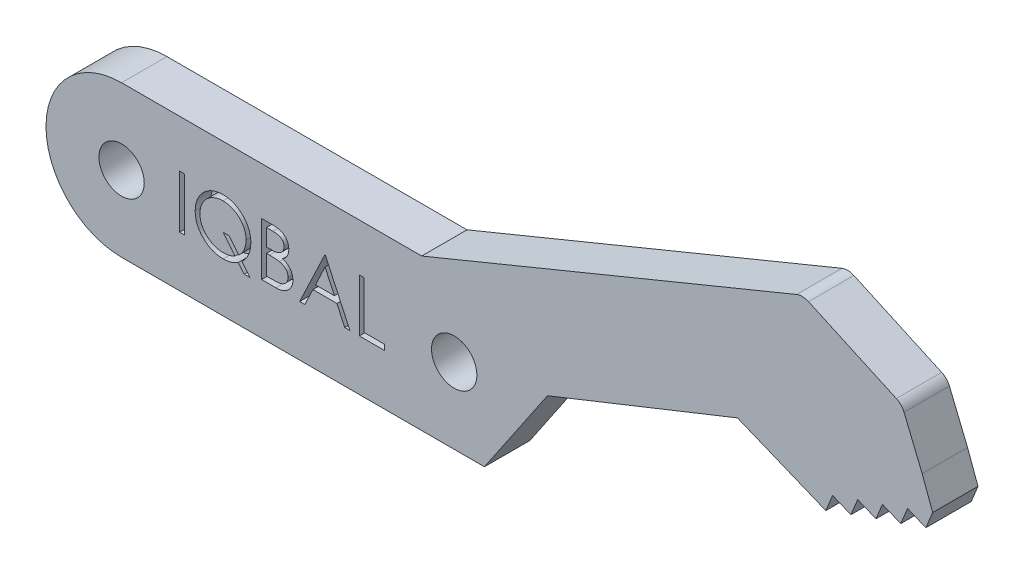
from build123d import *

# Parameters (mm, degrees)
SKETCH1_R           = 1.5
BOSS_EXTRUDE1_DEPTH = 3
SKETCH2_W           = 0.314102564
SKETCH2_H           = 3.5
CUT_EXTRUDE1_DEPTH  = 1


with BuildPart() as part:
    # Sketch1 → Boss-Extrude1 (new body)
    with BuildSketch(Plane.XY):
        with BuildLine():
            Line((0, 5), (19.85, 5))
            Line((19.85, 5), (44.643069029, 15.193663072))
            ThreePointArc((44.643069029, 15.193663072), (45.042006379, 15.268610471), (45.43786686, 15.178818479))
            Line((45.43786686, 15.178818479), (51.245085043, 12.533540635))
            ThreePointArc((51.245085043, 12.533540635), (51.550738574, 12.317286013), (51.755428853, 12.003770413))
            Line((51.755428853, 12.003770413), (52.954960556, 9.086264498))
            Line((52.954960556, 9.086264498), (53.647413738, 7.201821951))
            Line((53.647413738, 7.201821951), (53.200417763, 6.109762155))
            Line((53.200417763, 6.109762155), (51.987413738, 6.606262365))
            Line((51.987413738, 6.606262365), (51.540417763, 5.514202569))
            Line((51.540417763, 5.514202569), (50.327413738, 6.010702778))
            Line((50.327413738, 6.010702778), (49.901790908, 4.970859901))
            Line((49.901790908, 4.970859901), (48.688786884, 5.467360111))
            Line((48.688786884, 5.467360111), (48.241790908, 4.375300315))
            Line((48.241790908, 4.375300315), (47.028786884, 4.871800524))
            Line((47.028786884, 4.871800524), (46.581790908, 3.779740729))
            Line((46.581790908, 3.779740729), (40.742047423, 6.170032768))
            Line((40.742047423, 6.170032768), (28.174379319, 1.158584034))
            Line((28.174379319, 1.158584034), (24, -5))
            Line((24, -5), (22, -5))
            Line((22, -5), (0, -5))
            ThreePointArc((0, -5), (-5, 0), (0, 5))
        make_face()
        Circle(SKETCH1_R, mode=Mode.SUBTRACT)
        with Locations((22, 0)):
            Circle(SKETCH1_R, mode=Mode.SUBTRACT)
    extrude(amount=BOSS_EXTRUDE1_DEPTH)

    # Sketch2 → Cut-Extrude1 (cut)
    # profile 1 of 5: a face of its own
    with BuildSketch(Plane.XY.offset(3)):
        with Locations((3.993825044, 0.107803469)):
            Rectangle(SKETCH2_W, SKETCH2_H)
    # profile 2 of 5: a face of its own
    with BuildSketch(Plane.XY.offset(3)):
        with BuildLine():
            Line((7.965680012, -1.252372813), (8.503440429, -1.9114273))
            Line((8.503440429, -1.9114273), (8.111513345, -1.9114273))
            Line((8.111513345, -1.9114273), (7.723091871, -1.436066723))
            add(Edge.make_bspline(
                [(7.723091871, -1.436066723), (7.684134778, -1.459740459), (7.606938214, -1.506651841), (7.486571576, -1.567118007), (7.363811276, -1.617433745), (7.238928933, -1.659003719), (7.112106445, -1.692278045), (6.982700706, -1.715371834), (6.851181062, -1.72878211), (6.76281866, -1.730883437), (6.718384339, -1.731940121)],
                knots=[0, 0, 0, 0, 1.030216282, 2.041455142, 3.041201647, 4.026904037, 5.014869161, 6.002481075, 6.995518502, 8, 8, 8, 8], degree=3))
            add(Edge.make_bspline(
                [(6.718384339, -1.731940121), (6.654723998, -1.730406774), (6.529459398, -1.727389605), (6.345489281, -1.701049148), (6.168905662, -1.660368629), (6.000060511, -1.601507964), (5.838769899, -1.526325482), (5.685108761, -1.433636206), (5.538998996, -1.324723991), (5.402597406, -1.200300612), (5.277871988, -1.064945306), (5.16843325, -0.920324267), (5.075380753, -0.768837308), (5.000142267, -0.609729009), (4.940430472, -0.444384522), (4.899738504, -0.271428727), (4.873399066, -0.091891207), (4.870364698, 0.030351964), (4.868825044, 0.09237879)],
                knots=[0, 0, 0, 0, 1.055750571, 2.07740284, 3.077223765, 4.05828044, 5.038417088, 6.02463293, 7.030503776, 8.057169806, 9.083586829, 10.080154041, 11.061747002, 12.027853603, 12.995569715, 13.972756451, 14.971366004, 16, 16, 16, 16], degree=3))
            add(Edge.make_bspline(
                [(4.868825044, 0.09237879), (4.869372837, 0.134010073), (4.870464573, 0.216980146), (4.883093725, 0.339867317), (4.901857515, 0.460731448), (4.928398168, 0.579070275), (4.963142097, 0.695368853), (5.004796481, 0.809397858), (5.055266311, 0.920863466), (5.112321229, 1.029537543), (5.175953829, 1.134478204), (5.245270265, 1.234191863), (5.320441061, 1.327695836), (5.401413001, 1.414947342), (5.48786271, 1.49613925), (5.57904679, 1.572608549), (5.676909467, 1.641510498), (5.778867841, 1.705586547), (5.885493686, 1.76193256), (5.994701401, 1.812304094), (6.107307918, 1.853174247), (6.22185216, 1.888000569), (6.339029055, 1.914588478), (6.458747278, 1.933214717), (6.580922607, 1.945965684), (6.663430247, 1.947016716), (6.705063025, 1.947547059)],
                knots=[0, 0, 0, 0, 1.030721839, 2.054201982, 3.056261636, 4.058906239, 5.055198403, 6.060579377, 7.06322398, 8.083343201, 9.098870418, 10.10084648, 11.0888991, 12.067804703, 13.046436456, 14.024708667, 15.012489976, 16.008294399, 17.005242112, 17.997338632, 18.984424362, 19.969624474, 20.960977749, 21.957320355, 22.969278161, 24, 24, 24, 24], degree=3))
            add(Edge.make_bspline(
                [(6.705063025, 1.947547059), (6.768723603, 1.946021411), (6.893757054, 1.94302494), (7.077271416, 1.916680511), (7.253334828, 1.875836749), (7.421821952, 1.817276052), (7.58258257, 1.741904233), (7.735549141, 1.64923364), (7.880958825, 1.54031421), (8.016647672, 1.415882499), (8.141079338, 1.280193658), (8.249998939, 1.134783994), (8.342668907, 0.981817341), (8.418043039, 0.821057029), (8.476595032, 0.652568754), (8.517524458, 0.47628393), (8.543743098, 0.292517011), (8.546772606, 0.167255506), (8.548312223, 0.103596738)],
                knots=[0, 0, 0, 0, 1.050672203, 2.063587442, 3.054842799, 4.031180399, 5.003107577, 5.981273811, 6.979214548, 7.998088659, 9.016962771, 10.014903508, 10.993069742, 11.96499692, 12.941334519, 13.932589877, 14.949327797, 16, 16, 16, 16], degree=3))
            add(Edge.make_bspline(
                [(8.548312223, 0.103596738), (8.546629605, 0.037359372), (8.543320832, -0.092892658), (8.515162604, -0.283893384), (8.469889118, -0.46634407), (8.405685846, -0.640125176), (8.322685524, -0.805205113), (8.222491658, -0.963234697), (8.103897902, -1.114202725), (8.012237847, -1.20583108), (7.965680012, -1.252372813)],
                knots=[0, 0, 0, 0, 1.045660934, 2.056233022, 3.041853582, 4.009978652, 4.97562384, 5.954545411, 6.961031197, 8, 8, 8, 8], degree=3))
        make_face()
        with BuildLine():
            add(Edge.make_bspline(
                [(7.754642352, -0.993658871), (7.792831033, -0.954875898), (7.867949861, -0.87858807), (7.965415064, -0.753480069), (8.049244916, -0.623432837), (8.116359839, -0.486716437), (8.169758911, -0.345043724), (8.206651804, -0.197292139), (8.229751885, -0.044134317), (8.232712809, 0.060045038), (8.234209659, 0.112711322)],
                knots=[0, 0, 0, 0, 1.052210109, 2.069743939, 3.061837814, 4.040478349, 5.010453814, 5.985306305, 6.981502329, 8, 8, 8, 8], degree=3))
            add(Edge.make_bspline(
                [(8.234209659, 0.112711322), (8.233818555, 0.146627754), (8.23304541, 0.213674565), (8.222414686, 0.312892082), (8.207375373, 0.409918251), (8.185603057, 0.504579713), (8.157565664, 0.59668468), (8.122937021, 0.686108117), (8.082391812, 0.773138513), (8.035124957, 0.857235237), (7.98301725, 0.938276401), (7.925014978, 1.015270912), (7.861934558, 1.087821762), (7.794465115, 1.157124557), (7.721305837, 1.22175071), (7.642719102, 1.281672519), (7.559673276, 1.338340074), (7.471757414, 1.389489858), (7.381160145, 1.436514103), (7.288411587, 1.477234188), (7.194290522, 1.511722642), (7.098942702, 1.539688349), (7.002491507, 1.561700921), (6.904767838, 1.576723406), (6.806024409, 1.587343184), (6.73967994, 1.588162512), (6.706465268, 1.5885727)],
                knots=[0, 0, 0, 0, 1.032958288, 2.041976502, 3.037103433, 4.023477888, 4.998866292, 5.968231228, 6.943073582, 7.921783703, 8.90545537, 9.876780072, 10.85618943, 11.833110341, 12.821898168, 13.827467856, 14.842673888, 15.88323808, 16.924703457, 17.951432745, 18.967462636, 19.976958182, 20.977218729, 21.979378626, 22.98839684, 24, 24, 24, 24], degree=3))
            add(Edge.make_bspline(
                [(6.706465268, 1.5885727), (6.673017507, 1.58815965), (6.606207899, 1.58733461), (6.506987753, 1.576782143), (6.409039808, 1.561684384), (6.312794859, 1.539781216), (6.217912067, 1.511761124), (6.124685942, 1.477064169), (6.032305741, 1.437349852), (5.942688439, 1.390355633), (5.855990835, 1.33876601), (5.773535927, 1.282661916), (5.696453701, 1.221483595), (5.624012959, 1.156216016), (5.556394634, 1.086355589), (5.493279465, 1.012367022), (5.435775865, 0.933391822), (5.38309175, 0.85084298), (5.33652703, 0.764630808), (5.294531562, 0.676310778), (5.260421913, 0.584909174), (5.232418614, 0.491157573), (5.209535681, 0.395289047), (5.194786742, 0.296747084), (5.184076275, 0.196146842), (5.183313445, 0.128165687), (5.182927608, 0.093781033)],
                knots=[0, 0, 0, 0, 1.013205451, 2.023808328, 3.020541854, 4.015386314, 5.012622987, 6.016502547, 7.02834558, 8.057881235, 9.080621846, 10.084476421, 11.077781791, 12.060654405, 13.037357686, 14.022218736, 15.005346502, 15.995617173, 16.98763393, 17.973029642, 18.956998942, 19.940662314, 20.93709383, 21.940823471, 22.958474994, 24, 24, 24, 24], degree=3))
            add(Edge.make_bspline(
                [(5.182927608, 0.093781033), (5.184241165, 0.043228122), (5.186825337, -0.056225094), (5.20824748, -0.202239579), (5.244164393, -0.342026069), (5.294413644, -0.475784546), (5.357494687, -0.604285968), (5.435940734, -0.72627145), (5.529417112, -0.841276368), (5.634387569, -0.950090648), (5.749856639, -1.048672028), (5.872265052, -1.135434406), (6.000567714, -1.209044596), (6.135167518, -1.268456608), (6.275060747, -1.316166464), (6.421351716, -1.348466989), (6.573084115, -1.369876646), (6.676475524, -1.371926409), (6.728901166, -1.372965762)],
                knots=[0, 0, 0, 0, 1.022526523, 2.011626, 2.97850031, 3.937665323, 4.897797383, 5.869804095, 6.865337375, 7.89202157, 8.925035373, 9.93268082, 10.923937058, 11.912550332, 12.905497077, 13.90928476, 14.939882052, 16, 16, 16, 16], degree=3))
            add(Edge.make_bspline(
                [(6.728901166, -1.372965762), (6.76491957, -1.372573391), (6.836161429, -1.371797309), (6.941215434, -1.361216691), (7.04369866, -1.346324252), (7.142662085, -1.323674312), (7.238963876, -1.295515454), (7.332030817, -1.261262746), (7.422356589, -1.220655872), (7.479789659, -1.188531057), (7.508548602, -1.172444928)],
                knots=[0, 0, 0, 0, 1.060694673, 2.097979151, 3.107774411, 4.11000626, 5.086069662, 6.061987343, 7.029562652, 8, 8, 8, 8], degree=3))
            Line((7.508548602, -1.172444928), (6.720487704, -0.206299095))
            Line((6.720487704, -0.206299095), (7.112414788, -0.206299095))
            Line((7.112414788, -0.206299095), (7.754642352, -0.993658871))
        make_face(mode=Mode.SUBTRACT)
    # profile 3 of 5: a face of its own
    with BuildSketch(Plane.XY.offset(3)):
        with BuildLine():
            Line((9.266260941, 1.857803469), (9.94915357, 1.857803469))
            add(Edge.make_bspline(
                [(9.94915357, 1.857803469), (9.982582048, 1.857627719), (10.047374758, 1.857287071), (10.1415942, 1.85200394), (10.229843011, 1.84480027), (10.312146783, 1.833370177), (10.388467485, 1.8195784), (10.459035123, 1.802876584), (10.523625295, 1.78284997), (10.600738031, 1.751003689), (10.688658692, 1.703680521), (10.783857085, 1.633751955), (10.865261324, 1.548219492), (10.935447641, 1.451736837), (10.991248761, 1.345601065), (11.031618058, 1.232341876), (11.057175934, 1.113420134), (11.059804368, 1.031776957), (11.061132736, 0.990515809)],
                knots=[0, 0, 0, 0, 1.001505555, 1.941167018, 2.826882275, 3.653841531, 4.429895133, 5.150066043, 5.825578002, 6.45369114, 7.647487171, 8.808567382, 9.977351308, 11.170798116, 12.373658725, 13.556498008, 14.765093433, 16, 16, 16, 16], degree=3))
            add(Edge.make_bspline(
                [(11.061132736, 0.990515809), (11.060039518, 0.951863253), (11.057891241, 0.875907336), (11.037348481, 0.764813227), (11.005187813, 0.659062008), (10.960482564, 0.559039623), (10.902380567, 0.46700601), (10.833522249, 0.382218743), (10.750445446, 0.308267686), (10.688202206, 0.266924784), (10.656585461, 0.245924463)],
                knots=[0, 0, 0, 0, 1.044552857, 2.05264487, 3.044412934, 4.028983338, 5.005914585, 5.980388656, 6.974128949, 8, 8, 8, 8], degree=3))
            add(Edge.make_bspline(
                [(10.656585461, 0.245924463), (10.696345888, 0.230659464), (10.772417436, 0.201453739), (10.877103448, 0.149818275), (10.967298293, 0.093656165), (11.043695439, 0.032324315), (11.109033094, -0.033784496), (11.166086036, -0.10563961), (11.21476741, -0.184178368), (11.256480333, -0.268581903), (11.289029089, -0.357988372), (11.313404994, -0.451559148), (11.327372443, -0.548958703), (11.329360084, -0.615244082), (11.330363506, -0.648706948)],
                knots=[0, 0, 0, 0, 1.27268992, 2.434971085, 3.483601985, 4.442670788, 5.356604649, 6.2567628, 7.179492994, 8.113709626, 9.066344395, 10.018646069, 10.999752585, 12, 12, 12, 12], degree=3))
            add(Edge.make_bspline(
                [(11.330363506, -0.648706948), (11.32938666, -0.68287382), (11.327464688, -0.750098098), (11.313284716, -0.848853232), (11.289275609, -0.943228179), (11.256204462, -1.033833362), (11.213042148, -1.120493496), (11.160514184, -1.20330676), (11.09788262, -1.281441091), (11.027819751, -1.355764714), (10.948557605, -1.422592501), (10.863041851, -1.482108208), (10.770195531, -1.53105427), (10.671543537, -1.572170291), (10.565979221, -1.60357749), (10.453976613, -1.625550064), (10.335632311, -1.640355101), (10.25442256, -1.641572306), (10.212775365, -1.642196531)],
                knots=[0, 0, 0, 0, 0.978564426, 1.925352924, 2.850884081, 3.763762016, 4.682927383, 5.618979971, 6.567305752, 7.547517671, 8.540179244, 9.531824382, 10.526200242, 11.540722885, 12.589160233, 13.674978461, 14.80764778, 16, 16, 16, 16], degree=3))
            Line((10.212775365, -1.642196531), (9.266260941, -1.642196531))
            Line((9.266260941, -1.642196531), (9.266260941, 1.857803469))
        make_face()
        with BuildLine():
            Line((9.580363506, 1.49882911), (9.580363506, 0.377034238))
            Line((9.580363506, 0.377034238), (9.791401166, 0.377034238))
            add(Edge.make_bspline(
                [(9.791401166, 0.377034238), (9.822249961, 0.377434161), (9.88185612, 0.378206894), (9.968176017, 0.380420411), (10.048301035, 0.386618455), (10.122092868, 0.392814717), (10.189435312, 0.402889304), (10.250179174, 0.414881427), (10.305277771, 0.427564332), (10.368817316, 0.449133819), (10.440890265, 0.481011494), (10.517723369, 0.530483331), (10.585457838, 0.589407684), (10.642655026, 0.657398646), (10.689466497, 0.732264831), (10.721980212, 0.812811712), (10.744027496, 0.897031844), (10.746019027, 0.954850097), (10.747030172, 0.984205713)],
                knots=[0, 0, 0, 0, 1.156816544, 2.235205308, 3.236616184, 4.169592532, 5.011045266, 5.787822928, 6.49130361, 7.128639758, 8.301311294, 9.436451833, 10.541879658, 11.654887649, 12.756523258, 13.837046038, 14.901820046, 16, 16, 16, 16], degree=3))
            add(Edge.make_bspline(
                [(10.747030172, 0.984205713), (10.746503992, 1.003631484), (10.745471832, 1.041737256), (10.73701853, 1.097286611), (10.722650955, 1.149530363), (10.704196662, 1.199184473), (10.678407973, 1.244696324), (10.64804451, 1.287639519), (10.61135882, 1.326551638), (10.569601507, 1.362921136), (10.521592884, 1.395165664), (10.467361592, 1.423406427), (10.406173915, 1.446147204), (10.33906106, 1.466063356), (10.264989973, 1.48005165), (10.184815419, 1.491705038), (10.0978807, 1.49763778), (10.037735598, 1.498423143), (10.006645557, 1.49882911)],
                knots=[0, 0, 0, 0, 0.91205012, 1.789085906, 2.630437955, 3.453916878, 4.269457761, 5.079663411, 5.91843418, 6.774407191, 7.675494373, 8.627863946, 9.638891023, 10.736472738, 11.911756761, 13.175263542, 14.539845004, 16, 16, 16, 16], degree=3))
            Line((10.006645557, 1.49882911), (9.580363506, 1.49882911))
        make_face(mode=Mode.SUBTRACT)
        with BuildLine():
            Line((9.580363506, 0.018059879), (9.580363506, -1.283222172))
            Line((9.580363506, -1.283222172), (10.027679211, -1.283222172))
            add(Edge.make_bspline(
                [(10.027679211, -1.283222172), (10.059698137, -1.282838424), (10.121410395, -1.282098802), (10.210511625, -1.279684247), (10.293094729, -1.274191972), (10.368782865, -1.265546122), (10.438393317, -1.256167673), (10.50109102, -1.243556392), (10.557384214, -1.229107431), (10.622658522, -1.206773259), (10.69616203, -1.172076788), (10.775372886, -1.119762562), (10.845799104, -1.057439254), (10.905604364, -0.98530834), (10.954617352, -0.906877013), (10.990272807, -0.823731663), (11.012263664, -0.737246136), (11.014925833, -0.678279423), (11.016260941, -0.648706948)],
                knots=[0, 0, 0, 0, 1.160039823, 2.235823828, 3.228722157, 4.157150951, 4.99529583, 5.772374946, 6.472645482, 7.099169577, 8.269452708, 9.405989375, 10.527446681, 11.663510218, 12.788923519, 13.866172445, 14.929861265, 16, 16, 16, 16], degree=3))
            add(Edge.make_bspline(
                [(11.016260941, -0.648706948), (11.015984837, -0.630213607), (11.015437082, -0.593525225), (11.007176467, -0.539609406), (10.995162597, -0.487383533), (10.979631163, -0.436705792), (10.957011696, -0.388492416), (10.930605151, -0.341789856), (10.89964375, -0.296536377), (10.851399584, -0.239324123), (10.781227599, -0.173407111), (10.681520824, -0.108869608), (10.568148526, -0.056821801), (10.485921033, -0.034722325), (10.443444435, -0.023306306)],
                knots=[0, 0, 0, 0, 0.723448775, 1.435228256, 2.130040452, 2.821711965, 3.505591119, 4.210454504, 4.921174351, 5.648778258, 7.137944449, 8.670945889, 10.280296675, 12, 12, 12, 12], degree=3))
            add(Edge.make_bspline(
                [(10.443444435, -0.023306306), (10.426415339, -0.019851223), (10.389492747, -0.012359888), (10.329285166, -0.004452184), (10.260549297, 0.002592875), (10.18312642, 0.007804033), (10.096918579, 0.013190577), (10.00174166, 0.015285398), (9.897984346, 0.017784658), (9.825991973, 0.017965792), (9.788596679, 0.018059879)],
                knots=[0, 0, 0, 0, 0.634451884, 1.375622551, 2.216452059, 3.157844607, 4.20941857, 5.370758133, 6.634282058, 8, 8, 8, 8], degree=3))
            Line((9.788596679, 0.018059879), (9.580363506, 0.018059879))
        make_face(mode=Mode.SUBTRACT)
    # profile 4 of 5: a face of its own
    with BuildSketch(Plane.XY.offset(3)):
        Polygon((13.484209659, 1.857803469), (15.099594275, -1.642196531), (14.758147961, -1.642196531), (14.240720076, -0.520401659), (12.654081454, -0.520401659), (12.121930012, -1.642196531), (11.779081454, -1.642196531), (13.439337865, 1.857803469), align=None)
        Polygon((13.458268153, 1.175611963), (12.82445405, -0.1614273), (14.075255332, -0.1614273), align=None, mode=Mode.SUBTRACT)
    # profile 5 of 5: a face of its own
    with BuildSketch(Plane.XY.offset(3)):
        Polygon((15.727799403, 1.857803469), (16.041901967, 1.857803469), (16.041901967, -1.283222172), (17.388055813, -1.283222172), (17.388055813, -1.642196531), (15.727799403, -1.642196531), align=None)
    extrude(amount=-CUT_EXTRUDE1_DEPTH, mode=Mode.SUBTRACT)


solid = part.part
